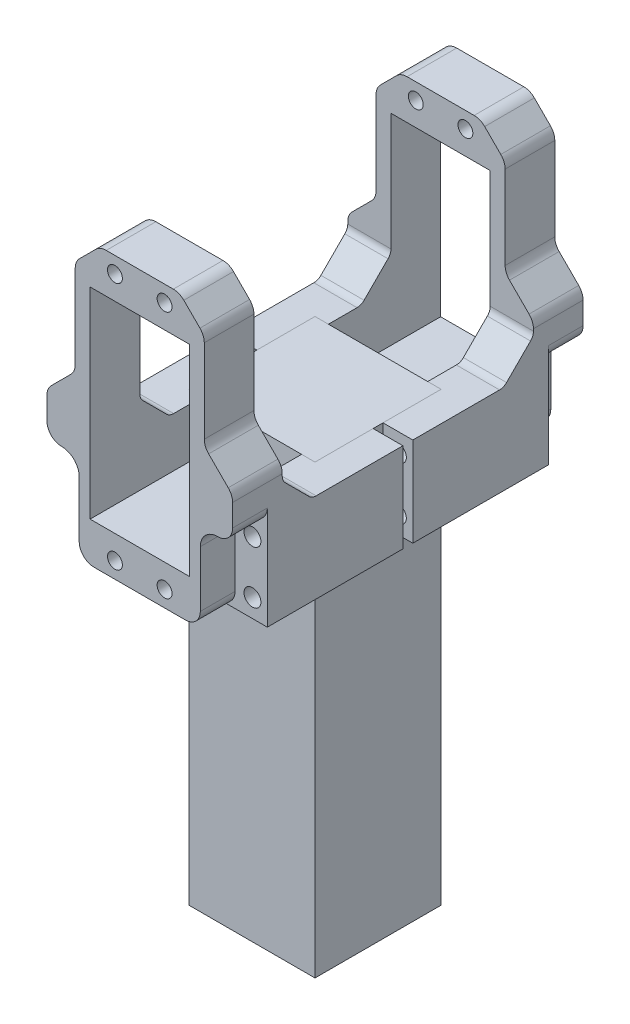
from build123d import *

# Parameters (mm, degrees)
SKETCH1_W           = 25.4
SKETCH1_H           = 25.4
BOSS_EXTRUDE1_DEPTH = 90
BOSS_EXTRUDE2_START = 25.3
SKETCH2_W           = 37.4
SKETCH2_H           = 56.5
SKETCH2_W_2         = 20
SKETCH2_H_2         = 40.5
BOSS_EXTRUDE2_DEPTH = 10
SKETCH3_W           = 6
SKETCH3_H           = 18
SKETCH3_R           = 1.7
BOSS_EXTRUDE3_DEPTH = 24.3
BOSS_EXTRUDE4_DEPTH = 12.6
SKETCH3_2_R         = 1.7
CUT_EXTRUDE1_DEPTH  = 100.467029713
CUT_EXTRUDE2_DEPTH  = 104.7
CHAMFER3_SIZE       = 5
FILLET4_R           = 3
CUT_EXTRUDE3_DEPTH  = 7
SKETCH10_R          = 1.5
CUT_EXTRUDE4_DEPTH  = 15
CHAMFER2_SIZE       = 6
FILLET2_R           = 2
FILLET3_R           = 3


with BuildPart() as part:
    # Sketch1 → Boss-Extrude1 (new body)
    with BuildSketch(Plane(origin=(0, 0, 0), x_dir=(1, 0, 0), z_dir=(0, 1, 0))):
        Rectangle(SKETCH1_W, SKETCH1_H)
    extrude(amount=-BOSS_EXTRUDE1_DEPTH)


with BuildPart() as body_2:
    # Sketch2 → Boss-Extrude2 (new body)
    with BuildSketch(Plane.XY.offset(BOSS_EXTRUDE2_START)):
        with Locations((0, 10.25)):
            Rectangle(SKETCH2_W, SKETCH2_H)
        with Locations((0, 10.25)):
            Rectangle(SKETCH2_W_2, SKETCH2_H_2, mode=Mode.SUBTRACT)
    extrude(amount=BOSS_EXTRUDE2_DEPTH)

    # Sketch3 → Boss-Extrude3 (add)
    # profile 1 of 2: a face of its own
    with BuildSketch(Plane(origin=(0, 0, 25.3), x_dir=(-1, 0, 0), z_dir=(0, 0, -1))):
        with Locations((-15.7, -9)):
            Rectangle(SKETCH3_W, SKETCH3_H)
        with Locations(Location((-15.7, -14.3, 0), (0, 0, 180))):
            Circle(SKETCH3_R, mode=Mode.SUBTRACT)
        with Locations(Location((-15.7, -3.7, 0), (0, 0, 180))):
            Circle(SKETCH3_R, mode=Mode.SUBTRACT)
    # profile 2 of 2: a face of its own
    with BuildSketch(Plane(origin=(0, 0, 25.3), x_dir=(-1, 0, 0), z_dir=(0, 0, -1))):
        with Locations((15.7, -9)):
            Rectangle(SKETCH3_W, SKETCH3_H)
        with Locations(Location((15.7, -3.7, 0), (0, 0, 180))):
            Circle(SKETCH3_R, mode=Mode.SUBTRACT)
        with Locations(Location((15.7, -14.3, 0), (0, 0, 180))):
            Circle(SKETCH3_R, mode=Mode.SUBTRACT)
    extrude(amount=BOSS_EXTRUDE3_DEPTH)

    # Sketch6 → Boss-Extrude4 (add)
    with BuildSketch(Plane(origin=(0, 0, 25.3), x_dir=(-1, 0, 0), z_dir=(0, 0, -1))):
        Polygon((-12.7, -18), (-12.7, 0), (-10, 0), (-10, -10), (10, -10), (10, 0), (12.7, 0), (12.7, -18), align=None)
    extrude(amount=BOSS_EXTRUDE4_DEPTH)

    # Sketch3<2> → Cut-Extrude1 (cut, through all)
    with BuildSketch(Plane(origin=(0, 0, 25.3), x_dir=(-1, 0, 0), z_dir=(0, 0, -1))):
        with Locations(Location((15.7, -3.7, 0), (0, 0, 180))):
            Circle(SKETCH3_2_R)
        with Locations(Location((15.7, -14.3, 0), (0, 0, 180))):
            Circle(SKETCH3_2_R)
        with Locations(Location((-15.7, -14.3, 0), (0, 0, 180))):
            Circle(SKETCH3_2_R)
        with Locations(Location((-15.7, -3.7, 0), (0, 0, 180))):
            Circle(SKETCH3_2_R)
    extrude(amount=-CUT_EXTRUDE1_DEPTH, mode=Mode.SUBTRACT)

    # Sketch7 → Cut-Extrude2 (cut, through all)
    with BuildSketch(Plane.XY.offset(35.3)):
        Polygon((-18.7, 8.5), (-13, 14.2), (-13, 38.5), (-18.7, 38.5), align=None)
        Polygon((13, 38.5), (18.7, 38.5), (18.7, 8.5), (13, 14.2), align=None)
    extrude(amount=-CUT_EXTRUDE2_DEPTH, mode=Mode.SUBTRACT)

    # Chamfer3
    chamfer3_edges = [body_2.edges().sort_by_distance(p)[0] for p in [
        (13, 38.5, 30.3),
        (-13, 38.5, 30.3),
    ]]
    chamfer(chamfer3_edges, length=CHAMFER3_SIZE)

    # Fillet4
    fillet4_edges = [body_2.edges().sort_by_distance(p)[0] for p in [
        (-8, 38.5, 30.3),
        (8, 38.5, 30.3),
        (13, 33.5, 30.3),
        (-13, 33.5, 30.3),
    ]]
    fillet(fillet4_edges, radius=FILLET4_R)

    # Sketch8 → Cut-Extrude3 (cut)
    with BuildSketch(Plane.XY.offset(35.3)):
        with BuildLine():
            Line((15.7, -0.2), (18.7, -0.2))
            Line((18.7, -0.2), (31.607326966, -25.992103599))
            Line((31.607326966, -25.992103599), (12.2, -18))
            Line((12.2, -18), (12.2, -3.7))
            ThreePointArc((12.2, -3.7), (13.225126266, -1.225126266), (15.7, -0.2))
        make_face()
        with BuildLine():
            Line((-12.2, -3.7), (-12.2, -18))
            Line((-12.2, -18), (-31.607326966, -25.992103599))
            Line((-31.607326966, -25.992103599), (-18.7, -0.2))
            Line((-18.7, -0.2), (-15.7, -0.2))
            ThreePointArc((-15.7, -0.2), (-13.225126266, -1.225126266), (-12.2, -3.7))
        make_face()
    extrude(amount=-CUT_EXTRUDE3_DEPTH, mode=Mode.SUBTRACT)

    # Sketch10 → Cut-Extrude4 (cut)
    with BuildSketch(Plane.XY.offset(35.3)):
        with Locations((-5, 35.25)):
            Circle(SKETCH10_R)
        with Locations((5, 35.25)):
            Circle(SKETCH10_R)
        with Locations((-5, -14.75)):
            Circle(SKETCH10_R)
        with Locations((5, -14.75)):
            Circle(SKETCH10_R)
    extrude(amount=-CUT_EXTRUDE4_DEPTH, mode=Mode.SUBTRACT)

    # Chamfer2
    chamfer2_edges = [body_2.edges().sort_by_distance(p)[0] for p in [
        (14.35, 0, 25.3),
        (-14.35, 0, 25.3),
    ]]
    chamfer(chamfer2_edges, length=CHAMFER2_SIZE)

    # Fillet2
    fillet2_edges = [body_2.edges().sort_by_distance(p)[0] for p in [
        (-14.35, 0, 19.3),
        (14.35, 6, 25.3),
        (-14.35, 6, 25.3),
        (14.35, 0, 19.3),
    ]]
    fillet(fillet2_edges, radius=FILLET2_R)

    # Fillet3
    fillet3_edges = [body_2.edges().sort_by_distance(p)[0] for p in [
        (-13, 14.2, 30.3),
        (-18.7, 8.5, 30.3),
        (-18.7, -0.2, 31.8),
        (-12.2, -18, 31.8),
        (12.2, -18, 31.8),
        (18.7, -0.2, 31.8),
        (18.7, 8.5, 30.3),
        (13, 14.2, 30.3),
    ]]
    fillet(fillet3_edges, radius=FILLET3_R - 0.0001)  # a hair under: the kernel refuses the full size


with BuildPart() as body_3:
    # Mirror1: mirrored copy
    add(body_2.part.mirror(Plane.XY))


solid = Compound([part.part, body_2.part, body_3.part])
